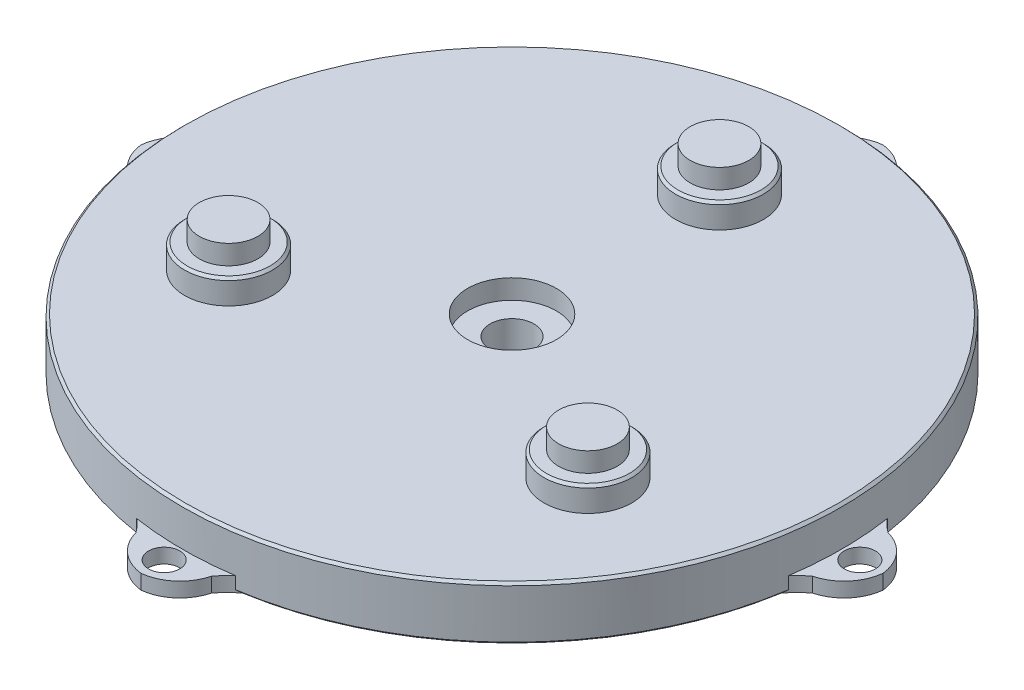
from build123d import *

# Parameters (mm, degrees)
SKETCH2_R            = 65
BOSS_EXTRUDE1_DEPTH  = 11
SKETCH3_R            = 9.1
CUT_EXTRUDE2_DEPTH   = 4
SKETCH4_R            = 4.5
CUT_EXTRUDE4_DEPTH   = 20
SKETCH5_R            = 67.5
SKETCH5_R_2          = 65
BOSS_EXTRUDE3_DEPTH  = 11
CHAMFER1_SIZE        = 0.5
CHAMFER2_SIZE        = 0.5
BOSS_EXTRUDE8_DEPTH  = 3
BOSS_EXTRUDE9_DEPTH  = 3
SKETCH8_R            = 3.2
CUT_EXTRUDE5_DEPTH   = 4
SKETCH9_R            = 9
BOSS_EXTRUDE10_DEPTH = 5
SKETCH10_R           = 6
BOSS_EXTRUDE11_DEPTH = 4
CHAMFER4_SIZE        = 0.5


with BuildPart() as part:
    # Sketch2 → Boss-Extrude1 (new body)
    with BuildSketch(Plane(origin=(0, 0, 0), x_dir=(1, 0, 0), z_dir=(0, 1, 0))):
        Circle(SKETCH2_R)
    extrude(amount=BOSS_EXTRUDE1_DEPTH)

    # Sketch3 → Cut-Extrude2 (cut)
    with BuildSketch(Plane(origin=(0, 11, 0), x_dir=(1, 0, 0), z_dir=(0, 1, 0))):
        Circle(SKETCH3_R)
    extrude(amount=-CUT_EXTRUDE2_DEPTH, mode=Mode.SUBTRACT)

    # Sketch4 → Cut-Extrude4 (cut)
    with BuildSketch(Plane(origin=(0, 7, 0), x_dir=(1, 0, 0), z_dir=(0, 1, 0))):
        Circle(SKETCH4_R)
    extrude(amount=-CUT_EXTRUDE4_DEPTH, mode=Mode.SUBTRACT)

    # Sketch5 → Boss-Extrude3 (add)
    with BuildSketch(Plane.XZ):
        Circle(SKETCH5_R)
        Circle(SKETCH5_R_2, mode=Mode.SUBTRACT)
    extrude(amount=-BOSS_EXTRUDE3_DEPTH)

    # Chamfer1
    chamfer1_edges = [part.edges().sort_by_distance(p)[0] for p in [
        (-67.5, 11, 0),
    ]]
    chamfer(chamfer1_edges, length=CHAMFER1_SIZE)

    # Chamfer2
    chamfer2_edges = [part.edges().sort_by_distance(p)[0] for p in [
        (-67.5, 0, 0),
    ]]
    chamfer(chamfer2_edges, length=CHAMFER2_SIZE)

    # Sketch6 → Boss-Extrude8 (add)
    with BuildSketch(Plane.XZ):
        with BuildLine():
            ThreePointArc((7.98307027, 66.522707319), (6.839267191, 67.654870524), (6.037545702, 69.050335199))
            ThreePointArc((6.037545702, 69.050335199), (3.933906239, 72.64143706), (0, 74))
            ThreePointArc((0, 74), (-3.933906239, 72.64143706), (-6.037545702, 69.050335199))
            ThreePointArc((-6.037545702, 69.050335199), (-6.839267191, 67.654870524), (-7.98307027, 66.522707319))
            ThreePointArc((-7.98307027, 66.522707319), (0, 67), (7.98307027, 66.522707319))
        make_face()
        with BuildLine():
            ThreePointArc((69.050335199, 6.037545702), (67.654870524, 6.839267191), (66.522707319, 7.98307027))
            ThreePointArc((66.522707319, 7.98307027), (67, 0), (66.522707319, -7.98307027))
            ThreePointArc((66.522707319, -7.98307027), (67.654870524, -6.839267191), (69.050335199, -6.037545702))
            ThreePointArc((69.050335199, -6.037545702), (72.64143706, -3.933906239), (74, 0))
            ThreePointArc((74, 0), (72.64143706, 3.933906239), (69.050335199, 6.037545702))
        make_face()
        with BuildLine():
            ThreePointArc((-66.522707319, 7.98307027), (-67.654870524, 6.839267191), (-69.050335199, 6.037545702))
            ThreePointArc((-69.050335199, 6.037545702), (-72.64143706, 3.933906239), (-74, 0))
            ThreePointArc((-74, 0), (-72.64143706, -3.933906239), (-69.050335199, -6.037545702))
            ThreePointArc((-69.050335199, -6.037545702), (-67.654870524, -6.839267191), (-66.522707319, -7.98307027))
            ThreePointArc((-66.522707319, -7.98307027), (-67, 0), (-66.522707319, 7.98307027))
        make_face()
        with BuildLine():
            ThreePointArc((-7.98307027, -66.522707319), (-6.839267191, -67.654870524), (-6.037545702, -69.050335199))
            ThreePointArc((-6.037545702, -69.050335199), (-3.933906239, -72.64143706), (0, -74))
            ThreePointArc((0, -74), (3.933906239, -72.64143706), (6.037545702, -69.050335199))
            ThreePointArc((6.037545702, -69.050335199), (6.839267191, -67.654870524), (7.98307027, -66.522707319))
            ThreePointArc((7.98307027, -66.522707319), (0, -67), (-7.98307027, -66.522707319))
        make_face()
    extrude(amount=-BOSS_EXTRUDE8_DEPTH)

    # Sketch7 → Boss-Extrude9 (add)
    with BuildSketch(Plane.XZ):
        with BuildLine():
            ThreePointArc((-6.037545702, 69.050335199), (-3.933906239, 72.64143706), (0, 74))
            ThreePointArc((0, 74), (3.933906239, 72.64143706), (6.037545702, 69.050335199))
            ThreePointArc((6.037545702, 69.050335199), (6.839267191, 67.654870524), (7.98307027, 66.522707319))
            ThreePointArc((7.98307027, 66.522707319), (9.478823757, 66.326102706), (10.969771462, 66.095870628))
            ThreePointArc((10.969771462, 66.095870628), (9.215149033, 67.574862202), (7.725710636, 69.320625418))
            ThreePointArc((7.725710636, 69.320625418), (4.902011553, 73.862254638), (0, 76))
            ThreePointArc((0, 76), (-4.902011553, 73.862254638), (-7.725710636, 69.320625418))
            ThreePointArc((-7.725710636, 69.320625418), (-9.215149033, 67.574862202), (-10.969771462, 66.095870628))
            ThreePointArc((-10.969771462, 66.095870628), (-9.478823757, 66.326102706), (-7.98307027, 66.522707319))
            ThreePointArc((-7.98307027, 66.522707319), (-6.839267191, 67.654870524), (-6.037545702, 69.050335199))
        make_face()
        with BuildLine():
            ThreePointArc((69.320625418, 7.725710636), (67.574862202, 9.215149033), (66.095870628, 10.969771462))
            ThreePointArc((66.095870628, 10.969771462), (66.326102706, 9.478823757), (66.522707319, 7.98307027))
            ThreePointArc((66.522707319, 7.98307027), (67.654870524, 6.839267191), (69.050335199, 6.037545702))
            ThreePointArc((69.050335199, 6.037545702), (72.64143706, 3.933906239), (74, 0))
            ThreePointArc((74, 0), (72.64143706, -3.933906239), (69.050335199, -6.037545702))
            ThreePointArc((69.050335199, -6.037545702), (67.654870524, -6.839267191), (66.522707319, -7.98307027))
            ThreePointArc((66.522707319, -7.98307027), (66.326102706, -9.478823757), (66.095870628, -10.969771462))
            ThreePointArc((66.095870628, -10.969771462), (67.574862202, -9.215149033), (69.320625418, -7.725710636))
            ThreePointArc((69.320625418, -7.725710636), (73.862254638, -4.902011553), (76, 0))
            ThreePointArc((76, 0), (73.862254638, 4.902011553), (69.320625418, 7.725710636))
        make_face()
        with BuildLine():
            ThreePointArc((-66.095870628, 10.969771462), (-67.574862202, 9.215149033), (-69.320625418, 7.725710636))
            ThreePointArc((-69.320625418, 7.725710636), (-73.862254638, 4.902011553), (-76, 0))
            ThreePointArc((-76, 0), (-73.862254638, -4.902011553), (-69.320625418, -7.725710636))
            ThreePointArc((-69.320625418, -7.725710636), (-67.574862202, -9.215149033), (-66.095870628, -10.969771462))
            ThreePointArc((-66.095870628, -10.969771462), (-66.326102706, -9.478823757), (-66.522707319, -7.98307027))
            ThreePointArc((-66.522707319, -7.98307027), (-67.654870524, -6.839267191), (-69.050335199, -6.037545702))
            ThreePointArc((-69.050335199, -6.037545702), (-72.64143706, -3.933906239), (-74, 0))
            ThreePointArc((-74, 0), (-72.64143706, 3.933906239), (-69.050335199, 6.037545702))
            ThreePointArc((-69.050335199, 6.037545702), (-67.654870524, 6.839267191), (-66.522707319, 7.98307027))
            ThreePointArc((-66.522707319, 7.98307027), (-66.326102706, 9.478823757), (-66.095870628, 10.969771462))
        make_face()
        with BuildLine():
            ThreePointArc((7.725710636, -69.320625418), (9.215149033, -67.574862202), (10.969771462, -66.095870628))
            ThreePointArc((10.969771462, -66.095870628), (9.478823757, -66.326102706), (7.98307027, -66.522707319))
            ThreePointArc((7.98307027, -66.522707319), (6.839267191, -67.654870524), (6.037545702, -69.050335199))
            ThreePointArc((6.037545702, -69.050335199), (3.933906239, -72.64143706), (0, -74))
            ThreePointArc((0, -74), (-3.933906239, -72.64143706), (-6.037545702, -69.050335199))
            ThreePointArc((-6.037545702, -69.050335199), (-6.839267191, -67.654870524), (-7.98307027, -66.522707319))
            ThreePointArc((-7.98307027, -66.522707319), (-9.478823757, -66.326102706), (-10.969771462, -66.095870628))
            ThreePointArc((-10.969771462, -66.095870628), (-9.215149033, -67.574862202), (-7.725710636, -69.320625418))
            ThreePointArc((-7.725710636, -69.320625418), (-4.902011553, -73.862254638), (0, -76))
            ThreePointArc((0, -76), (4.902011553, -73.862254638), (7.725710636, -69.320625418))
        make_face()
    extrude(amount=-BOSS_EXTRUDE9_DEPTH)

    # Sketch8 → Cut-Extrude5 (cut)
    with BuildSketch(Plane.XZ):
        with Locations((0, 71.25)):
            Circle(SKETCH8_R)
        with Locations((71.25, 0)):
            Circle(SKETCH8_R)
        with Locations((0, -71.25)):
            Circle(SKETCH8_R)
        with Locations((-71.25, 0)):
            Circle(SKETCH8_R)
    extrude(amount=-CUT_EXTRUDE5_DEPTH, mode=Mode.SUBTRACT)

    # Sketch9 → Boss-Extrude10 (add)
    with BuildSketch(Plane(origin=(0, 11, 0), x_dir=(1, 0, 0), z_dir=(0, 1, 0))):
        with Locations((0, 42.5)):
            Circle(SKETCH9_R)
        with Locations((-36.806079661, -21.25)):
            Circle(SKETCH9_R)
        with Locations((36.806079661, -21.25)):
            Circle(SKETCH9_R)
    extrude(amount=BOSS_EXTRUDE10_DEPTH)

    # Sketch10 → Boss-Extrude11 (add)
    with BuildSketch(Plane(origin=(0, 16, 0), x_dir=(1, 0, 0), z_dir=(0, 1, 0))):
        with Locations((0, 42.5)):
            Circle(SKETCH10_R)
        with Locations((36.806079661, -21.25)):
            Circle(SKETCH10_R)
        with Locations((-36.806079661, -21.25)):
            Circle(SKETCH10_R)
    extrude(amount=BOSS_EXTRUDE11_DEPTH)

    # Chamfer4
    chamfer4_edges = [part.edges().sort_by_distance(p)[0] for p in [
        (27.806079661, 16, 21.25),
        (-45.806079661, 16, 21.25),
        (-9, 16, -42.5),
    ]]
    chamfer(chamfer4_edges, length=CHAMFER4_SIZE)


solid = part.part
